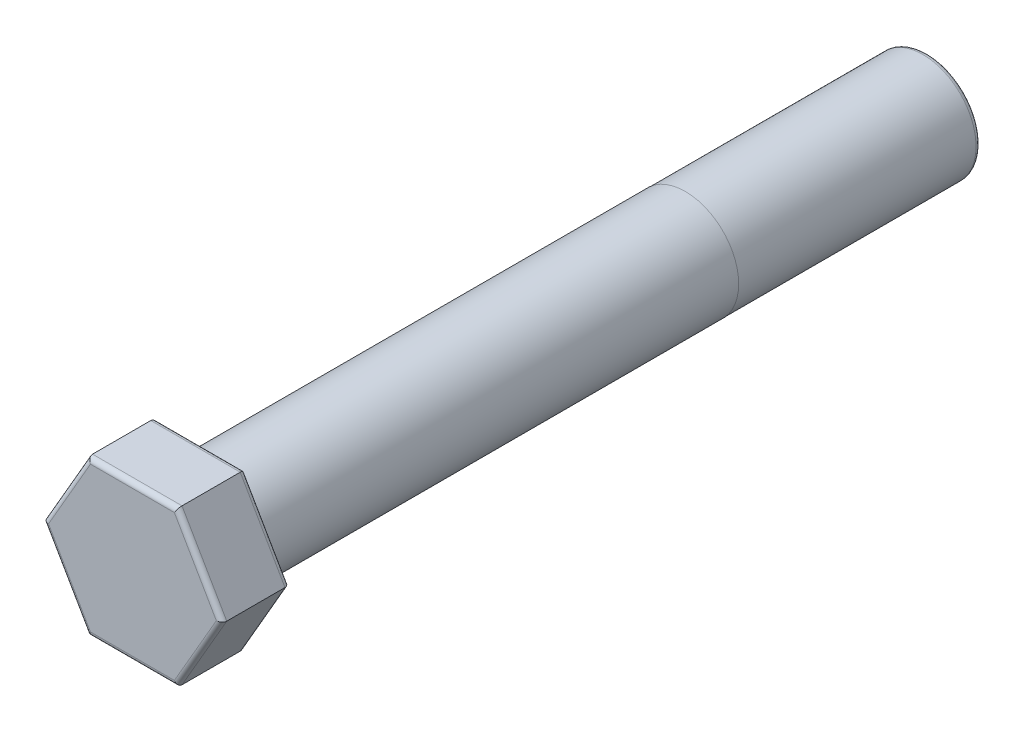
from build123d import *

# Parameters (mm, degrees)
EXTRUDE_1_DEPTH = 14
SKETCH_3_R      = 11
EXTRUDE_2_DEPTH = 100
SKETCH_4_R      = 10.95
EXTRUDE_4_DEPTH = 50
FILLET_2_R      = 1


with BuildPart() as part:
    # 草图2 → 拉伸1 (new body)
    with BuildSketch(Plane.XY):
        Polygon((9.225, -15.9781687), (18.45, 0), (9.225, 15.9781687), (-9.225, 15.9781687), (-18.45, 0), (-9.225, -15.9781687), align=None)
    extrude(amount=EXTRUDE_1_DEPTH)

    # 草图3 → 拉伸2 (add)
    with BuildSketch(Plane(origin=(0, 0, 0), x_dir=(-1, 0, 0), z_dir=(0, 0, -1))):
        Circle(SKETCH_3_R)
    extrude(amount=EXTRUDE_2_DEPTH)

    # 草图4 → 拉伸4 (add)
    with BuildSketch(Plane(origin=(0, 0, -100), x_dir=(-1, 0, 0), z_dir=(0, 0, -1))):
        Circle(SKETCH_4_R)
    extrude(amount=EXTRUDE_4_DEPTH)

    # 圆角2
    fillet_2_edges = [part.edges().sort_by_distance(p)[0] for p in [
        (10.95, 0, -150),
        (13.8375, 7.98908435, 0),
        (13.8375, -7.98908435, 0),
        (0, -15.9781687, 14),
        (-13.8375, -7.98908435, 14),
        (-13.8375, 7.98908435, 14),
        (0, 15.9781687, 14),
        (13.8375, 7.98908435, 14),
        (13.8375, -7.98908435, 14),
        (0, 15.9781687, 0),
        (-13.8375, 7.98908435, 0),
        (-13.8375, -7.98908435, 0),
        (0, -15.9781687, 0),
    ]]
    fillet(fillet_2_edges, radius=FILLET_2_R)


solid = part.part
